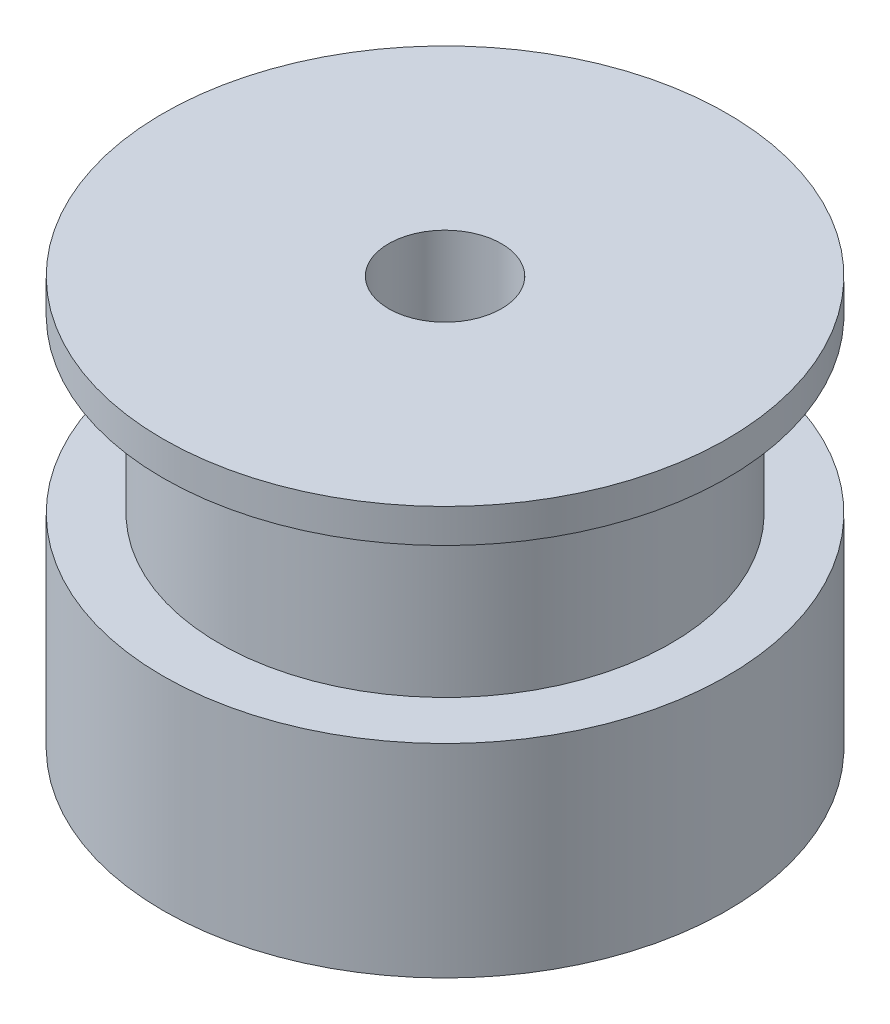
from build123d import *

# Parameters (mm, degrees)
SKETCH1_R           = 12.5
BOSS_EXTRUDE1_DEPTH = 9
SKETCH2_R           = 10
BOSS_EXTRUDE2_DEPTH = 7.6
SKETCH3_R           = 12.5
BOSS_EXTRUDE3_DEPTH = 1.5
SKETCH4_R           = 2.5
CUT_EXTRUDE1_DEPTH  = 26.300395254


with BuildPart() as part:
    # Sketch1 → Boss-Extrude1 (new body)
    with BuildSketch(Plane(origin=(0, 0, 0), x_dir=(1, 0, 0), z_dir=(0, 1, 0))):
        Circle(SKETCH1_R)
    extrude(amount=BOSS_EXTRUDE1_DEPTH)

    # Sketch2 → Boss-Extrude2 (add)
    with BuildSketch(Plane(origin=(0, 9, 0), x_dir=(1, 0, 0), z_dir=(0, 1, 0))):
        Circle(SKETCH2_R)
    extrude(amount=BOSS_EXTRUDE2_DEPTH)

    # Sketch3 → Boss-Extrude3 (add)
    with BuildSketch(Plane(origin=(0, 16.6, 0), x_dir=(1, 0, 0), z_dir=(0, 1, 0))):
        Circle(SKETCH3_R)
    extrude(amount=BOSS_EXTRUDE3_DEPTH)

    # Sketch4 → Cut-Extrude1 (cut, through all)
    with BuildSketch(Plane(origin=(0, 18.1, 0), x_dir=(1, 0, 0), z_dir=(0, 1, 0))):
        Circle(SKETCH4_R)
    extrude(amount=-CUT_EXTRUDE1_DEPTH, mode=Mode.SUBTRACT)


solid = part.part
